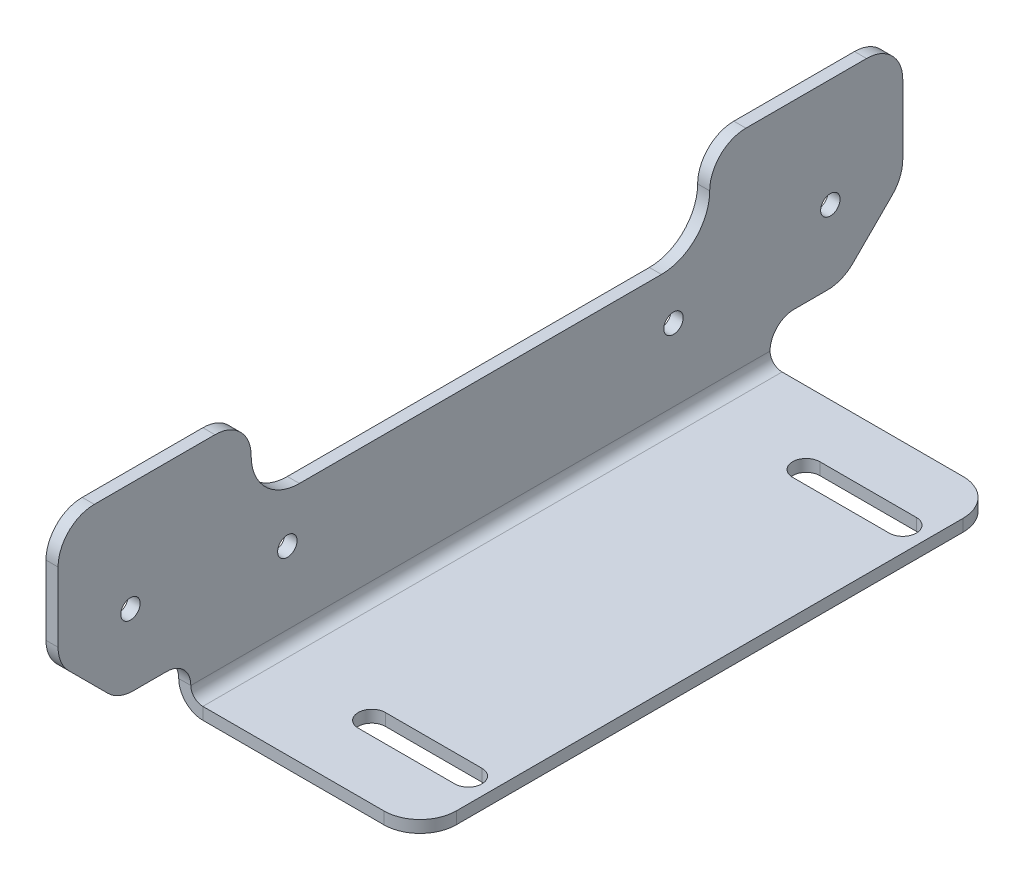
from build123d import *

# Parameters (mm, degrees)
BASE_FLANGE1_DEPTH          = 111.125
CUT_EXTRUDE1_REACH          = 143.492
F_1_4_20_TAPPED_HOLE1_D     = 5.1054
EXTRUDE1_REACH              = 143.492
SKETCH5_W                   = 120.65
SKETCH5_H                   = 22.225
FILLET2_R                   = 12.7
F_1_4_20_TAPPED_HOLE2_D     = 5.1054
F_1_4_20_TAPPED_HOLE2_DEPTH = 16.51
F_1_4_20_TAPPED_HOLE2_TIP   = 1.533816902
SKETCH8_W                   = 63.5
SKETCH8_H                   = 34.925
CUT_EXTRUDE2_DEPTH          = 12.7
CHAMFER1_SIZE               = 15.875
FILLET3_R                   = 9.525
FILLET4_R                   = 9.525
FILLET5_R                   = 6.35


# Sheet-metal steps are written as plain solids
with BuildPart() as part:
    # Sketch1 → Base-Flange1 (new, symmetric)
    with BuildSketch(Plane.XY):
        with BuildLine():
            Line((0, 60.325), (0, 6.35))
            ThreePointArc((0, 6.35), (1.859871939, 1.859871939), (6.35, 0))
            Line((6.35, 0), (63.5, 0))
            Line((63.5, 0), (63.5, 3.175))
            Line((63.5, 3.175), (6.35, 3.175))
            ThreePointArc((6.35, 3.175), (4.10493597, 4.10493597), (3.175, 6.35))
            Line((3.175, 6.35), (3.175, 60.325))
            Line((3.175, 60.325), (0, 60.325))
        make_face()
    extrude(amount=BASE_FLANGE1_DEPTH, both=True)

    # Sketch2 → Cut-Extrude1 (cut, up to next)
    with BuildSketch(Plane.XZ, mode=Mode.PRIVATE) as cut_extrude1_sk1:
        with BuildLine():
            Line((31.75, 60.721875), (57.15, 60.721875))
            ThreePointArc((57.15, 60.721875), (60.721875, 57.15), (57.15, 53.578125))
            Line((57.15, 53.578125), (31.75, 53.578125))
            ThreePointArc((31.75, 53.578125), (28.178125, 57.15), (31.75, 60.721875))
        make_face()
    cut_extrude1_tool1 = extrude(cut_extrude1_sk1.sketch, amount=-CUT_EXTRUDE1_REACH, mode=Mode.PRIVATE) & part.part
    # Sketch2 → Cut-Extrude1 (cut, up to next)
    with BuildSketch(Plane.XZ, mode=Mode.PRIVATE) as cut_extrude1_sk2:
        with BuildLine():
            Line((31.75, -53.578125), (57.15, -53.578125))
            ThreePointArc((57.15, -53.578125), (60.721875, -57.15), (57.15, -60.721875))
            Line((57.15, -60.721875), (31.75, -60.721875))
            ThreePointArc((31.75, -60.721875), (28.178125, -57.15), (31.75, -53.578125))
        make_face()
    cut_extrude1_tool2 = extrude(cut_extrude1_sk2.sketch, amount=-CUT_EXTRUDE1_REACH, mode=Mode.PRIVATE) & part.part
    add(cut_extrude1_tool1.solids().sort_by_distance((44.45, 0, 57.15))[0], mode=Mode.SUBTRACT)
    add(cut_extrude1_tool2.solids().sort_by_distance((44.45, 0, -57.15))[0], mode=Mode.SUBTRACT)

    # 1/4-20 Tapped Hole1 (through all)
    with Locations(Plane.ZY):
        with Locations((-92.075, 31.75), (92.075, 31.75)):
            Hole(F_1_4_20_TAPPED_HOLE1_D / 2)

    # Sketch5 → Extrude1 (cut, up to next)
    with BuildSketch(Plane.ZY, mode=Mode.PRIVATE) as extrude1_sk1:
        with Locations((0, 49.2125)):
            Rectangle(SKETCH5_W, SKETCH5_H)
    extrude1_tool1 = extrude(extrude1_sk1.sketch, amount=-EXTRUDE1_REACH, mode=Mode.PRIVATE) & part.part
    add(extrude1_tool1.solids().sort_by_distance((0, 49.2125, 0))[0], mode=Mode.SUBTRACT)

    # Fillet2
    fillet2_edges = [part.edges().sort_by_distance(p)[0] for p in [
        (1.5875, 38.1, -60.325),
        (1.5875, 38.1, 60.325),
    ]]
    fillet(fillet2_edges, radius=FILLET2_R)

    # 1/4-20 Tapped Hole2
    with Locations(Plane(origin=(3.175, 0, 0), x_dir=(0, 0, -1), z_dir=(1, 0, 0))):
        with Locations((-50.8, 25.4), (50.8, 25.4)):
            Hole(F_1_4_20_TAPPED_HOLE2_D / 2, depth=F_1_4_20_TAPPED_HOLE2_DEPTH)
            with Locations((0, 0, -(F_1_4_20_TAPPED_HOLE2_DEPTH + F_1_4_20_TAPPED_HOLE2_TIP / 2))):  # 118° drill point
                Cone(0, F_1_4_20_TAPPED_HOLE2_D / 2, F_1_4_20_TAPPED_HOLE2_TIP, mode=Mode.SUBTRACT)

    # Sketch8 → Cut-Extrude2 (cut)
    with BuildSketch(Plane.XZ):
        with Locations((31.75, 93.6625)):
            Rectangle(SKETCH8_W, SKETCH8_H)
        with Locations((31.75, -93.6625)):
            Rectangle(SKETCH8_W, SKETCH8_H)
    extrude(amount=-CUT_EXTRUDE2_DEPTH, mode=Mode.SUBTRACT)

    # Chamfer1
    chamfer1_edges = [part.edges().sort_by_distance(p)[0] for p in [
        (1.5875, 12.7, 111.125),
        (1.5875, 12.7, -111.125),
    ]]
    chamfer(chamfer1_edges, length=CHAMFER1_SIZE)

    # Fillet3
    fillet3_edges = [part.edges().sort_by_distance(p)[0] for p in [
        (1.5875, 60.325, -111.125),
        (1.5875, 60.325, -60.325),
        (1.5875, 60.325, 60.325),
        (1.5875, 60.325, 111.125),
        (63.5, 1.5875, -76.2),
        (63.5, 1.5875, 76.2),
    ]]
    fillet(fillet3_edges, radius=FILLET3_R - 0.0001)  # a hair under: the kernel refuses the full size

    # Fillet4
    fillet4_edges = [part.edges().sort_by_distance(p)[0] for p in [
        (1.5875, 12.7, 95.25),
        (1.5875, 28.575, 111.125),
        (1.5875, 12.7, -95.25),
        (1.5875, 28.575, -111.125),
    ]]
    fillet(fillet4_edges, radius=FILLET4_R)

    # Fillet5
    fillet5_edges = [part.edges().sort_by_distance(p)[0] for p in [
        (1.5875, 12.7, -76.2),
        (1.5875, 12.7, 76.2),
    ]]
    fillet(fillet5_edges, radius=FILLET5_R)


solid = part.part
